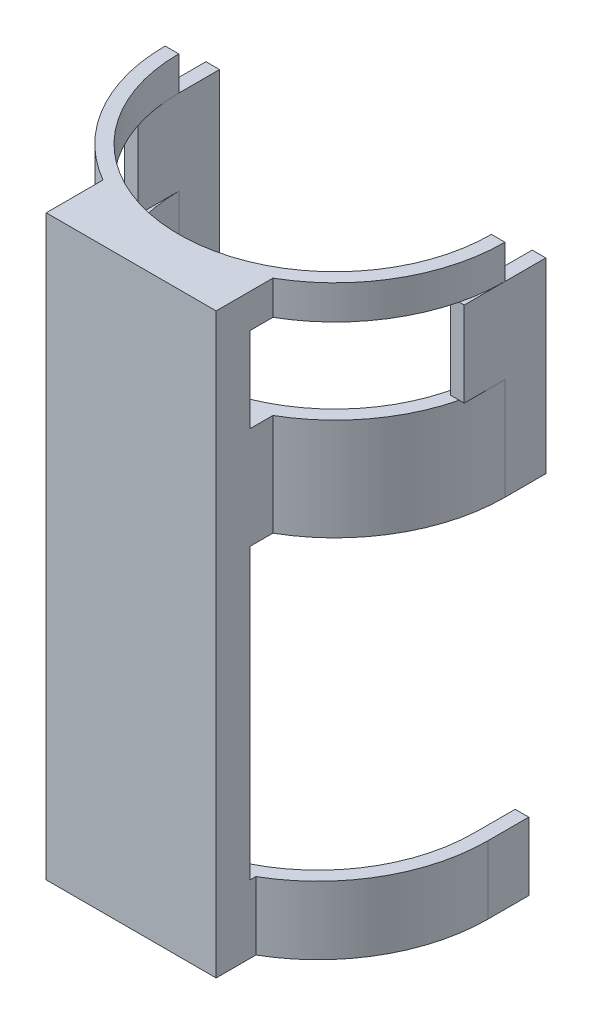
from build123d import *

# Parameters (mm, degrees)
SKETCH_1_W      = 50
SKETCH_1_H      = 10
EXTRUDE_1_DEPTH = 160
EXTRUDE_START   = 105
EXTRUDE_3_DEPTH = 30
EXTRUDE_9_DEPTH = 20
SKETCH_3_W      = 4
SKETCH_3_H      = 24
EXTRUDE_4_DEPTH = 25
EXTRUDE_8_DEPTH = 10


# Read off the part's stored shape, not the designer's step: 凸台-拉伸3
with BuildPart() as part:
    # 草图1 → 凸台-拉伸1 (new body)
    with BuildSketch(Plane(origin=(0, 0, 0), x_dir=(1, 0, 0), z_dir=(0, 1, 0))):
        Rectangle(SKETCH_1_W, SKETCH_1_H)
    extrude(amount=EXTRUDE_1_DEPTH)

    # 凸台-拉伸3 outline → 凸台-拉伸3 (add)
    with BuildSketch(Plane(origin=(0, 0, 0), x_dir=(1, 0, 0), z_dir=(0, 1, 0)).offset(EXTRUDE_START)):
        with BuildLine():
            Line((-25, 11.698729811), (-25, 5))
            Line((-25, 5), (25, 5))
            Line((25, 5), (25, 11.698729811))
            ThreePointArc((25, 11.698729811), (43.301270189, 30), (50, 55))
            Line((50, 55), (50, 67))
            Line((50, 67), (46, 67))
            Line((46, 67), (46, 55))
            ThreePointArc((46, 55), (0, 9), (-46, 55))
            Line((-46, 55), (-46, 67))
            Line((-46, 67), (-50, 67))
            Line((-50, 67), (-50, 55))
            ThreePointArc((-50, 55), (-43.301270189, 30), (-25, 11.698729811))
        make_face()
    extrude(amount=EXTRUDE_3_DEPTH)

    # 草图6 → 凸台-拉伸9 (add)
    with BuildSketch(Plane.XZ):
        with BuildLine():
            Line((-17.162962033, 1.601757508), (17.472067362, 1.754788629))
            Line((17.472067362, 1.754788629), (25, -5))
            Line((25, -5), (25, -6.698729811))
            ThreePointArc((25, -6.698729811), (43.301270189, -25), (50, -50))
            Line((50, -50), (50, -62))
            Line((50, -62), (46, -62))
            Line((46, -62), (46, -50))
            ThreePointArc((46, -50), (0, -4), (-46, -50))
            Line((-46, -50), (-46, -62))
            Line((-46, -62), (-50, -62))
            Line((-50, -62), (-50, -50))
            ThreePointArc((-50, -50), (-43.301270189, -25), (-25, -6.698729811))
            Line((-25, -6.698729811), (-25, -5))
            Line((-25, -5), (-17.162962033, 1.601757508))
        make_face()
    extrude(amount=-EXTRUDE_9_DEPTH)

    # 草图3 → 凸台-拉伸4 (add)
    with BuildSketch(Plane(origin=(0, 135, 0), x_dir=(1, 0, 0), z_dir=(0, 1, 0))):
        with Locations((-48, 55)):
            Rectangle(SKETCH_3_W, SKETCH_3_H)
        with Locations((48, 55)):
            Rectangle(SKETCH_3_W, SKETCH_3_H)
    extrude(amount=EXTRUDE_4_DEPTH)

    # 草图4 → 凸台-拉伸8 (add)
    with BuildSketch(Plane(origin=(0, 160, 0), x_dir=(1, 0, 0), z_dir=(0, 1, 0))):
        with BuildLine():
            Line((-50, 55), (-46, 55))
            ThreePointArc((-46, 55), (0, 9), (46, 55))
            Line((46, 55), (50, 55))
            ThreePointArc((50, 55), (43.301270189, 30), (25, 11.698729811))
            Line((25, 11.698729811), (25, -5))
            Line((25, -5), (-25, -5))
            Line((-25, -5), (-25, 11.698729811))
            ThreePointArc((-25, 11.698729811), (-43.301270189, 30), (-50, 55))
        make_face()
    extrude(amount=EXTRUDE_8_DEPTH)


solid = part.part
